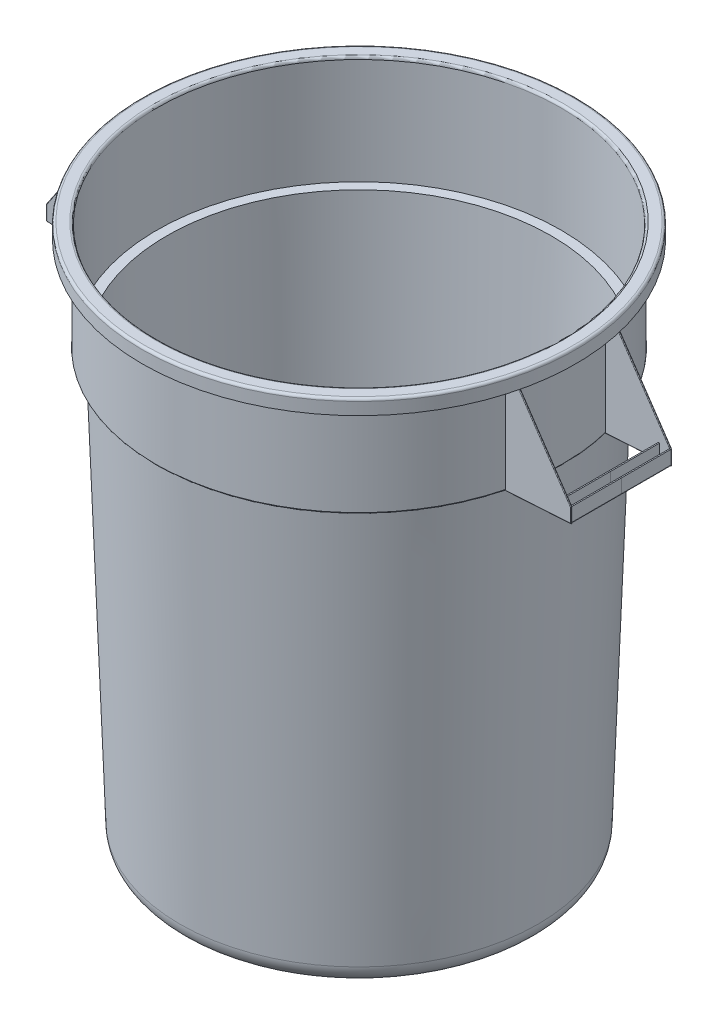
from build123d import *

# Parameters (mm, degrees)
FILLET3_R                = 3.175
FILLET4_R                = 25.4
BOSS_EXTRUDE1_DEPTH      = 63.5
BOSS_EXTRUDE3_REACH      = 971.135
BOSS_EXTRUDE3_END_RADIUS = 262.179479106
SKETCH5_W                = 1.5875
SKETCH5_H                = 122.2375
CUT_EXTRUDE1_DEPTH       = 1.5875
FILLET7_R                = 1.5875
FILLET11_R               = 1.5875
FILLET12_R               = 0.79375


with BuildPart() as part:
    # Sketch2 → Revolve2 (revolve)
    with BuildSketch(Plane.XY, mode=Mode.PRIVATE) as revolve2_sk:
        Polygon((-279.641979106, 673.1), (-278.054479106, 673.1), (-278.054479106, 690.5625), (-262.179479106, 690.5625), (-262.179479106, 550.8625), (-249.425010036, 550.8625), (-230.13303093, -1.5875), (-157.1625, -1.5875), (-157.1625, 33.3375), (0, 33.3375), (0, 34.925), (-158.75, 34.925), (-158.75, 0), (-228.6, 0), (-247.891979106, 552.45), (-260.591979106, 552.45), (-260.591979106, 692.15), (-279.641979106, 692.15), align=None)
    revolve(revolve2_sk.sketch.rotate(Axis((0, 0, 0), (0, 1, 0)), 270), axis=Axis((0, 0, 0), (0, 1, 0)))

    # Fillet3
    fillet3_edges = [part.edges().sort_by_distance(p)[0] for p in [
        (0, 692.15, 279.641979106),
        (0, 692.15, 260.591979106),
        (0, 0, 158.75),
        (0, 34.925, 158.75),
        (0, 33.3375, 157.1625),
        (0, -1.5875, 157.1625),
        (0, 690.5625, 262.179479106),
        (0, 690.5625, 278.054479106),
    ]]
    fillet(fillet3_edges, radius=FILLET3_R)

    # Fillet4
    fillet4_edges = [part.edges().sort_by_distance(p)[0] for p in [
        (0, 0, 228.6),
        (0, -1.5875, 230.13303093),
    ]]
    fillet(fillet4_edges, radius=FILLET4_R)

    # Fillet11
    fillet11_edges = [part.edges().sort_by_distance(p)[0] for p in [
        (0, 550.8625, 262.179479106),
    ]]
    fillet(fillet11_edges, radius=FILLET11_R)


with BuildPart() as body_2:
    # Sketch3 → Boss-Extrude1 (new body)
    with BuildSketch(Plane.XY.offset(63.5)):
        Polygon((-324.091979106, 557.584473052), (-324.091979106, 575.046973052), (-322.504479106, 575.046973052), (-322.504479106, 555.996973052), (-338.379479106, 555.996973052), (-338.379479106, 575.046973052), (-336.791979106, 575.046973052), (-336.791979106, 557.584473052), align=None)
    extrude(amount=-BOSS_EXTRUDE1_DEPTH)

    # Fillet7
    fillet7_edges = [body_2.edges().sort_by_distance(p)[0] for p in [
        (-336.791979106, 557.584473052, 31.75),
        (-338.379479106, 555.996973052, 31.75),
        (-322.504479106, 555.996973052, 31.75),
        (-324.091979106, 557.584473052, 31.75),
    ]]
    fillet(fillet7_edges, radius=FILLET7_R)


with BuildPart() as body_3:
    # Boss-Extrude3: up to this cylinder (the profile starts outside it)
    boss_extrude3_end = Plane(origin=(0, 611.98125, 0), z_dir=(0, -1, 0)) * Cylinder(BOSS_EXTRUDE3_END_RADIUS, 2467.628958211, mode=Mode.PRIVATE)
    # Sketch5 → Boss-Extrude3 (new, up to the surface)
    with BuildSketch(Plane.ZY.offset(338.379479106), mode=Mode.PRIVATE) as boss_extrude3_sk1:
        with Locations((64.29375, 611.98125)):
            Rectangle(SKETCH5_W, SKETCH5_H)
    boss_extrude3_tool1 = extrude(boss_extrude3_sk1.sketch, amount=-BOSS_EXTRUDE3_REACH, mode=Mode.PRIVATE) - boss_extrude3_end
    add(boss_extrude3_tool1.solids().sort_by_distance((-338.379479, 611.98125, 64.29375))[0])

    # Sketch6 → Cut-Extrude1 (cut)
    with BuildSketch(Plane.XY.offset(65.0875)):
        Polygon((-253.971842156, 550.8625), (-338.379479106, 555.996973052), (-338.379479106, 550.8625), align=None)
        Polygon((-338.379479106, 575.046973052), (-338.379479106, 673.1), (-271.961860969, 673.1), align=None)
    extrude(amount=-CUT_EXTRUDE1_DEPTH, mode=Mode.SUBTRACT)

    # Fillet12
    # the kernel refuses this fillet: 0.79375 mm, written as the material it takes off along each edge
    with BuildSketch(Plane(origin=(-252.392691343, 550.76644107, 63.5), x_dir=(0.0607172545305091, 0.9981550054987839, 0), z_dir=(-0.9981550054987839, 0.06071725453050909, 0))) as fillet12_piece_1:
        with BuildLine():
            CenterArc((FILLET12_R, -FILLET12_R), FILLET12_R, 90, 90)
            Line((0, -FILLET12_R), (0, 0))
            Line((0, 0), (FILLET12_R, 0))
        make_face()
    extrude(amount=88.130101153, mode=Mode.SUBTRACT)
    with BuildSketch(Plane(origin=(-251.991128317, 550.742014198, 65.0875), x_dir=(0.0607172545305091, 0.9981550054987839, 0), z_dir=(-0.9981550054987839, 0.06071725453050909, 0))) as fillet12_piece_2:
        with BuildLine():
            CenterArc((FILLET12_R, FILLET12_R), FILLET12_R, 180, 90)
            Line((0, FILLET12_R), (0, 0))
            Line((0, 0), (FILLET12_R, 0))
        make_face()
    extrude(amount=88.532406431, mode=Mode.SUBTRACT)
    with BuildSketch(Plane(origin=(-270.848989953, 674.742943165, 63.5), x_dir=(0.8279398624936091, -0.560816889986441, 0), z_dir=(-0.560816889986441, -0.8279398624936091, 0)), Plane(origin=(-270.848989953, 674.742943165, 65.0875), x_dir=(0, 0, -1), z_dir=(-0.560816889986441, -0.8279398624936091, 0))) as fillet12_piece_3:
        with BuildLine():
            CenterArc((FILLET12_R, FILLET12_R), FILLET12_R, 180, 90)
            Line((0, FILLET12_R), (0, 0))
            Line((0, 0), (FILLET12_R, 0))
        make_face()
    extrude(amount=122.398881692, mode=Mode.SUBTRACT)
    with BuildSketch(Plane(origin=(-338.379479106, 554.012598052, 65.0875), x_dir=(0, 0, -1), z_dir=(0, 1, 0))) as fillet12_piece_4:
        with BuildLine():
            CenterArc((FILLET12_R, -FILLET12_R), FILLET12_R, 90, 90)
            Line((0, -FILLET12_R), (0, 0))
            Line((0, 0), (FILLET12_R, 0))
        make_face()
    extrude(amount=23.01875, mode=Mode.SUBTRACT)


with BuildPart() as body_4:
    # Mirror11: mirrored copy
    add(body_3.part.mirror(Plane.XY))


with BuildPart() as body_5:
    # Mirror11 2: mirrored copy
    add(body_2.part.mirror(Plane.XY))


with BuildPart() as body_6:
    # Mirror12: mirrored copy
    add(body_3.part.mirror(Plane(origin=(0, 0, 0), x_dir=(0, 0, 1), z_dir=(1, 0, 0))))


with BuildPart() as body_7:
    # Mirror12 2: mirrored copy
    add(body_2.part.mirror(Plane(origin=(0, 0, 0), x_dir=(0, 0, 1), z_dir=(1, 0, 0))))


with BuildPart() as body_8:
    # Mirror12 3: mirrored copy
    add(body_5.part.mirror(Plane(origin=(0, 0, 0), x_dir=(0, 0, 1), z_dir=(1, 0, 0))))


with BuildPart() as body_9:
    # Mirror12 4: mirrored copy
    add(body_4.part.mirror(Plane(origin=(0, 0, 0), x_dir=(0, 0, 1), z_dir=(1, 0, 0))))


solid = Compound([part.part, body_2.part, body_3.part, body_4.part, body_5.part, body_6.part, body_7.part, body_8.part, body_9.part])
